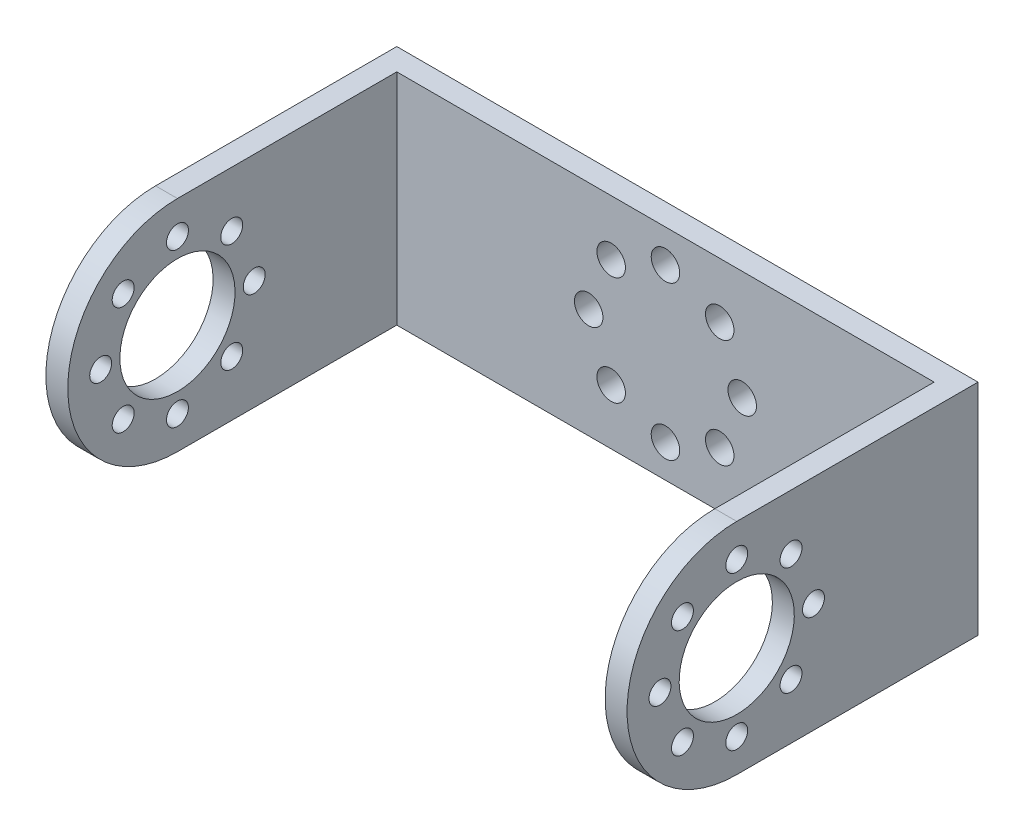
from build123d import *

# Parameters (mm, degrees)
SKETCH_1_W          = 53
SKETCH_1_H          = 20
EXTRUDE_1_DEPTH     = 2
SKETCH_2_W          = 2
SKETCH_2_H          = 20
EXTRUDE_2_DEPTH     = 30
CUT_EXTRUDE_START   = -30
CUT_EXTRUDE_1_DEPTH = 92.032778079
CUT_EXTRUDE_2_REACH = 64.714
SKETCH_4_R          = 1
SKETCH_4_R_2        = 5.25
SKETCH_5_R          = 1.3
CUT_EXTRUDE_3_DEPTH = 43.734646366


with BuildPart() as part:
    # 草圖1 → 填料-伸長1 (new body)
    with BuildSketch(Plane.XY):
        Rectangle(SKETCH_1_W, SKETCH_1_H)
    extrude(amount=EXTRUDE_1_DEPTH)

    # 草圖2 → 填料-伸長2 (add)
    with BuildSketch(Plane.XY.offset(2)):
        with Locations((-25.5, 0)):
            Rectangle(SKETCH_2_W, SKETCH_2_H)
    extrude_2 = extrude(amount=EXTRUDE_2_DEPTH)

    # 草圖3 → 除料-伸長1 (cut)
    with BuildSketch(Plane(origin=(-24.5, 0, 0), x_dir=(0, 0, -1), z_dir=(1, 0, 0)).offset(CUT_EXTRUDE_START)):
        with BuildLine():
            Line((-32, -10), (-22, -10))
            ThreePointArc((-22, -10), (-29.071067812, -7.071067812), (-32, 0))
            Line((-32, 0), (-32, -10))
        make_face()
        with BuildLine():
            Line((-32, 10), (-32, 0))
            ThreePointArc((-32, 0), (-29.071067812, 7.071067812), (-22, 10))
            Line((-22, 10), (-32, 10))
        make_face()
    cut_extrude_1 = extrude(amount=CUT_EXTRUDE_1_DEPTH, mode=Mode.SUBTRACT)

    # 草圖4 → 除料-伸長2 (cut, up to next)
    with BuildSketch(Plane.ZY.offset(26.5), mode=Mode.PRIVATE) as cut_extrude_2_sk1:
        with Locations((29, 0)):
            Circle(SKETCH_4_R)
    cut_extrude_2_tool1 = extrude(cut_extrude_2_sk1.sketch, amount=-CUT_EXTRUDE_2_REACH, mode=Mode.PRIVATE) & part.part
    # 草圖4 → 除料-伸長2 (cut, up to next)
    with BuildSketch(Plane.ZY.offset(26.5), mode=Mode.PRIVATE) as cut_extrude_2_sk2:
        with Locations((26.949747468, -4.949747468)):
            Circle(SKETCH_4_R)
    cut_extrude_2_tool2 = extrude(cut_extrude_2_sk2.sketch, amount=-CUT_EXTRUDE_2_REACH, mode=Mode.PRIVATE) & part.part
    # 草圖4 → 除料-伸長2 (cut, up to next)
    with BuildSketch(Plane.ZY.offset(26.5), mode=Mode.PRIVATE) as cut_extrude_2_sk3:
        with Locations((22, -7)):
            Circle(SKETCH_4_R)
    cut_extrude_2_tool3 = extrude(cut_extrude_2_sk3.sketch, amount=-CUT_EXTRUDE_2_REACH, mode=Mode.PRIVATE) & part.part
    # 草圖4 → 除料-伸長2 (cut, up to next)
    with BuildSketch(Plane.ZY.offset(26.5), mode=Mode.PRIVATE) as cut_extrude_2_sk4:
        with Locations((17.050252532, -4.949747468)):
            Circle(SKETCH_4_R)
    cut_extrude_2_tool4 = extrude(cut_extrude_2_sk4.sketch, amount=-CUT_EXTRUDE_2_REACH, mode=Mode.PRIVATE) & part.part
    # 草圖4 → 除料-伸長2 (cut, up to next)
    with BuildSketch(Plane.ZY.offset(26.5), mode=Mode.PRIVATE) as cut_extrude_2_sk5:
        with Locations((15, 0)):
            Circle(SKETCH_4_R)
    cut_extrude_2_tool5 = extrude(cut_extrude_2_sk5.sketch, amount=-CUT_EXTRUDE_2_REACH, mode=Mode.PRIVATE) & part.part
    # 草圖4 → 除料-伸長2 (cut, up to next)
    with BuildSketch(Plane.ZY.offset(26.5), mode=Mode.PRIVATE) as cut_extrude_2_sk6:
        with Locations((17.050252532, 4.949747468)):
            Circle(SKETCH_4_R)
    cut_extrude_2_tool6 = extrude(cut_extrude_2_sk6.sketch, amount=-CUT_EXTRUDE_2_REACH, mode=Mode.PRIVATE) & part.part
    # 草圖4 → 除料-伸長2 (cut, up to next)
    with BuildSketch(Plane.ZY.offset(26.5), mode=Mode.PRIVATE) as cut_extrude_2_sk7:
        with Locations((22, 7)):
            Circle(SKETCH_4_R)
    cut_extrude_2_tool7 = extrude(cut_extrude_2_sk7.sketch, amount=-CUT_EXTRUDE_2_REACH, mode=Mode.PRIVATE) & part.part
    # 草圖4 → 除料-伸長2 (cut, up to next)
    with BuildSketch(Plane.ZY.offset(26.5), mode=Mode.PRIVATE) as cut_extrude_2_sk8:
        with Locations((26.949747468, 4.949747468)):
            Circle(SKETCH_4_R)
    cut_extrude_2_tool8 = extrude(cut_extrude_2_sk8.sketch, amount=-CUT_EXTRUDE_2_REACH, mode=Mode.PRIVATE) & part.part
    # 草圖4 → 除料-伸長2 (cut, up to next)
    with BuildSketch(Plane.ZY.offset(26.5), mode=Mode.PRIVATE) as cut_extrude_2_sk9:
        with Locations((22, 0)):
            Circle(SKETCH_4_R_2)
    cut_extrude_2_tool9 = extrude(cut_extrude_2_sk9.sketch, amount=-CUT_EXTRUDE_2_REACH, mode=Mode.PRIVATE) & part.part
    cut_extrude_2_1 = cut_extrude_2_tool1.solids().sort_by_distance((-26.5, 0, 29))[0]
    add(cut_extrude_2_1, mode=Mode.SUBTRACT)
    cut_extrude_2_2 = cut_extrude_2_tool2.solids().sort_by_distance((-26.5, -4.949747, 26.949747))[0]
    add(cut_extrude_2_2, mode=Mode.SUBTRACT)
    cut_extrude_2_3 = cut_extrude_2_tool3.solids().sort_by_distance((-26.5, -7, 22))[0]
    add(cut_extrude_2_3, mode=Mode.SUBTRACT)
    cut_extrude_2_4 = cut_extrude_2_tool4.solids().sort_by_distance((-26.5, -4.949747, 17.050253))[0]
    add(cut_extrude_2_4, mode=Mode.SUBTRACT)
    cut_extrude_2_5 = cut_extrude_2_tool5.solids().sort_by_distance((-26.5, 0, 15))[0]
    add(cut_extrude_2_5, mode=Mode.SUBTRACT)
    cut_extrude_2_6 = cut_extrude_2_tool6.solids().sort_by_distance((-26.5, 4.949747, 17.050253))[0]
    add(cut_extrude_2_6, mode=Mode.SUBTRACT)
    cut_extrude_2_7 = cut_extrude_2_tool7.solids().sort_by_distance((-26.5, 7, 22))[0]
    add(cut_extrude_2_7, mode=Mode.SUBTRACT)
    cut_extrude_2_8 = cut_extrude_2_tool8.solids().sort_by_distance((-26.5, 4.949747, 26.949747))[0]
    add(cut_extrude_2_8, mode=Mode.SUBTRACT)
    cut_extrude_2_9 = cut_extrude_2_tool9.solids().sort_by_distance((-26.5, 0, 22))[0]
    add(cut_extrude_2_9, mode=Mode.SUBTRACT)
    cut_extrude_2 = cut_extrude_2_1 + cut_extrude_2_2 + cut_extrude_2_3 + cut_extrude_2_4 + cut_extrude_2_5 + cut_extrude_2_6 + cut_extrude_2_7 + cut_extrude_2_8 + cut_extrude_2_9  # 除料-伸長2 as one shape, for the pattern or mirror that repeats it

    # 鏡射1: 填料-伸長2, 除料-伸長1, 除料-伸長2 across plane
    add(extrude_2.mirror(Plane(origin=(0, 0, 0), x_dir=(0, 0, 1), z_dir=(1, 0, 0))))
    add(cut_extrude_1.mirror(Plane(origin=(0, 0, 0), x_dir=(0, 0, 1), z_dir=(1, 0, 0))), mode=Mode.SUBTRACT)
    add(cut_extrude_2.mirror(Plane(origin=(0, 0, 0), x_dir=(0, 0, 1), z_dir=(1, 0, 0))), mode=Mode.SUBTRACT)

    # 草圖5 → 除料-伸長3 (cut, through all)
    with BuildSketch(Plane(origin=(0, 0, 0), x_dir=(-1, 0, 0), z_dir=(0, 0, -1))):
        with Locations((-7, 0)):
            Circle(SKETCH_5_R)
        with Locations((-4.949747468, 4.949747468)):
            Circle(SKETCH_5_R)
        with Locations((0, 7)):
            Circle(SKETCH_5_R)
        with Locations((4.949747468, 4.949747468)):
            Circle(SKETCH_5_R)
        with Locations((7, 0)):
            Circle(SKETCH_5_R)
        with Locations((4.949747468, -4.949747468)):
            Circle(SKETCH_5_R)
        with Locations((0, -7)):
            Circle(SKETCH_5_R)
        with Locations((-4.949747468, -4.949747468)):
            Circle(SKETCH_5_R)
    extrude(amount=-CUT_EXTRUDE_3_DEPTH, mode=Mode.SUBTRACT)


solid = part.part
